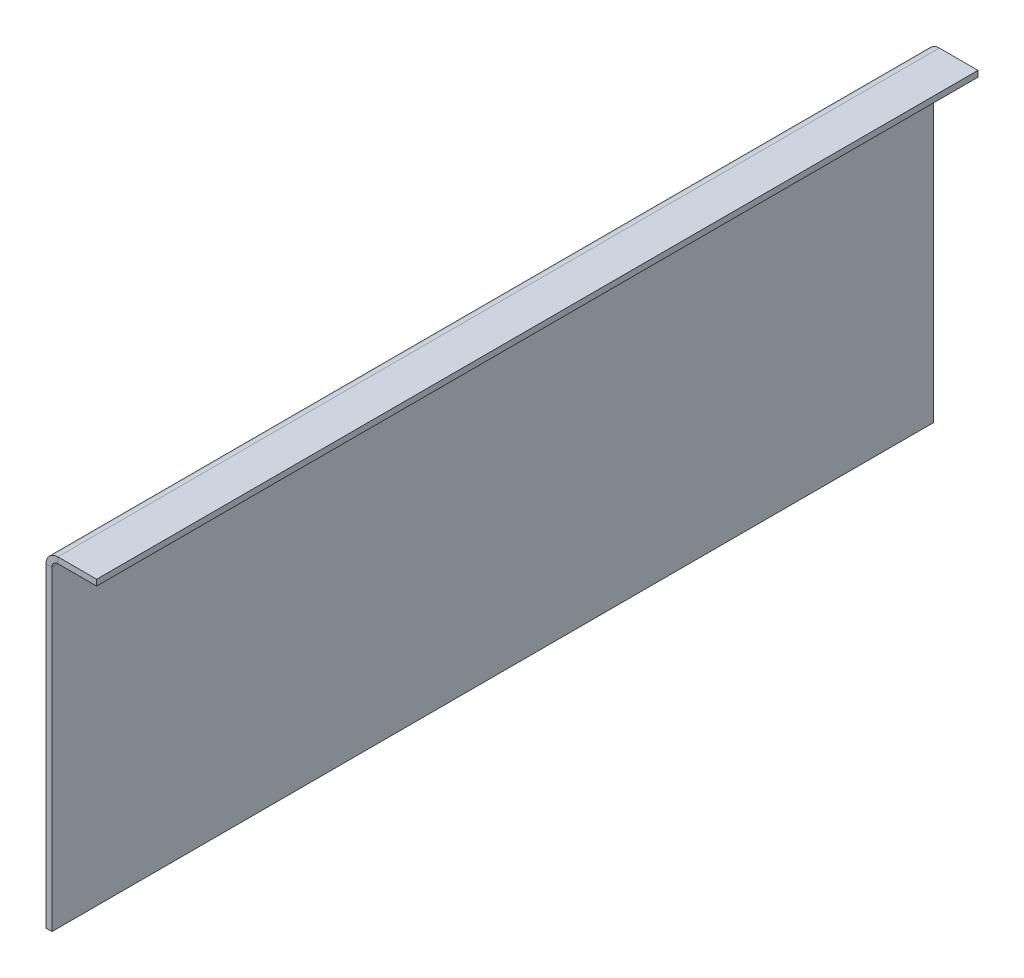
from build123d import *

# Parameters (mm, degrees)
BOSS_EXTRUDE1_DEPTH    = 148
CONVERT_SOLID1_START   = -148
CONVERT_SOLID1_DEPTH   = 296
CONVERT_SOLID1_2_DEPTH = 296


# Read off the part's stored shape, not the designer's step: Convert-Solid1
with BuildPart() as part:
    # Sketch1 → Boss-Extrude1 (new, symmetric)
    with BuildSketch(Plane.XY):
        Polygon((0, 0), (0, 110), (17, 110), (17, 108), (2, 108), (2, 0), align=None)
    extrude(amount=BOSS_EXTRUDE1_DEPTH, both=True)

    # Convert-Solid1 outline → Convert-Solid1 (cut)
    with BuildSketch(Plane.XY.offset(CONVERT_SOLID1_START)):
        with BuildLine():
            ThreePointArc((0, 106), (1.171572875, 108.828427125), (4, 110))
            Line((4, 110), (0, 110))
            Line((0, 110), (0, 106))
        make_face()
    extrude(amount=CONVERT_SOLID1_DEPTH, mode=Mode.SUBTRACT)

    # Convert-Solid1 2 outline → Convert-Solid1 2 (add)
    with BuildSketch(Plane.XY.offset(CONVERT_SOLID1_START)):
        with BuildLine():
            ThreePointArc((2, 106), (2.585786438, 107.414213562), (4, 108))
            Line((4, 108), (2, 108))
            Line((2, 108), (2, 106))
        make_face()
    extrude(amount=CONVERT_SOLID1_2_DEPTH)


solid = part.part
